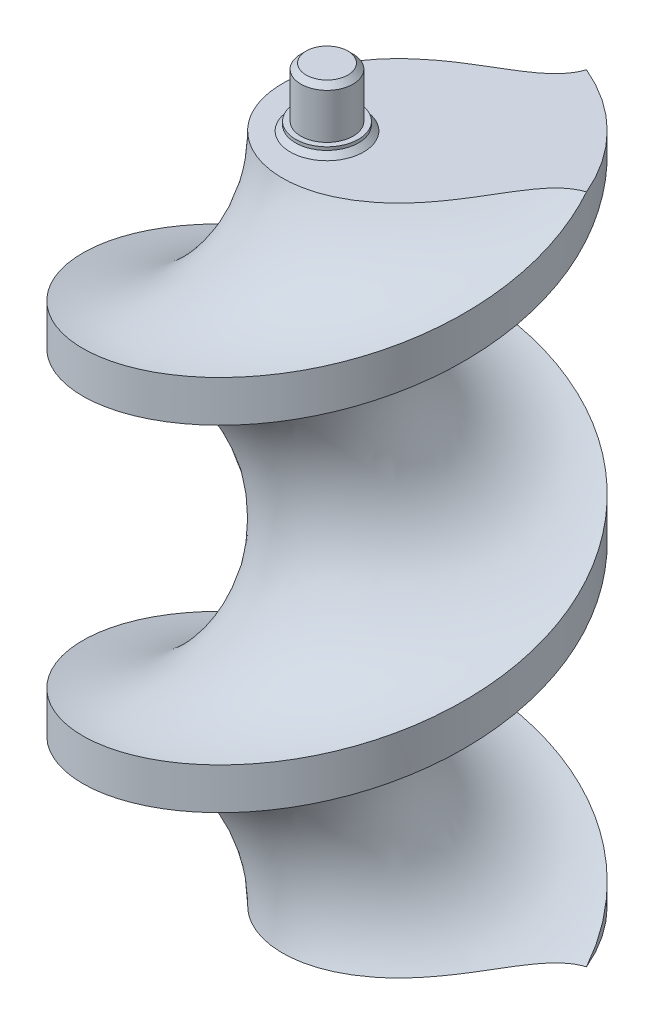
from build123d import *

# Parameters (mm, degrees)
SKETCH2_R           = 30
BOSS_EXTRUDE1_DEPTH = 50.8
CUT_SWEEP1_PITCH    = 50.8
SKETCH17_R          = 3.949999974
BOSS_EXTRUDE2_DEPTH = 8.89
SKETCH19_R          = 4.7625
BOSS_EXTRUDE3_DEPTH = 1.27
CHAMFER1_SIZE       = 0.79375
SKETCH20_W          = 5.08
SKETCH20_H          = 4.064
CUT_EXTRUDE1_DEPTH  = 7.62
SKETCH21_W          = 5.08
SKETCH21_H          = 5.08
CUT_EXTRUDE2_DEPTH  = 2.54


with BuildPart() as part:
    # Sketch2 → Boss-Extrude1 (new, symmetric)
    with BuildSketch(Plane(origin=(0, 0, 0), x_dir=(1, 0, 0), z_dir=(0, 1, 0))):
        with Locations(Location((0, 0, 0), (0, 0, 270))):
            Circle(SKETCH2_R)
    extrude(amount=BOSS_EXTRUDE1_DEPTH, both=True)

    # Cut-Sweep1: arcs per turn and ends read off the stored shape
    # Cut-Sweep1: the profile of Cut-Sweep1 profile screwed along a right-hand helix through 4 turns, 28 arcs to a turn; built about Z, then put on its axis
    cut_sweep1_z = Axis((0, 0, 0), (0, 0, 1))
    cut_sweep1_corners = [(51.5, 0, -50.8), (30, 5.594686686, -71.559322746), (8.5, 0, -50.8), (30, -5.594686686, -30.040677254)]
    with BuildLine(mode=Mode.PRIVATE) as cut_sweep1_profile:
        ThreePointArc((51.5, 0, -50.8), (45.202795796, 3.956040894, -65.479057887), (30, 5.594686686, -71.559322746))
        ThreePointArc((30, 5.594686686, -71.559322746), (14.797204204, 3.956040894, -65.479057887), (8.5, 0, -50.8))
        ThreePointArc((8.5, 0, -50.8), (14.797204204, -3.956040894, -36.120942113), (30, -5.594686686, -30.040677254))
        ThreePointArc((30, -5.594686686, -30.040677254), (45.202795796, -3.956040894, -36.120942113), (51.5, 0, -50.8))
    cut_sweep1_cap = Face(cut_sweep1_profile.wire())
    cut_sweep1_arcs = [((51.5, 0, -50.8), (51.5, 5.594686686, -71.559322746), (30, 5.594686686, -71.559322746), (1, 0.7071067811865476, 1)), ((30, 5.594686686, -71.559322746), (8.5, 5.594686686, -71.559322746), (8.5, 0, -50.8), (1, 0.7071067811865476, 1)), ((8.5, 0, -50.8), (8.5, -5.594686686, -30.040677254), (30, -5.594686686, -30.040677254), (1, 0.7071067811865476, 1)), ((30, -5.594686686, -30.040677254), (51.5, -5.594686686, -30.040677254), (51.5, 0, -50.8), (1, 0.7071067811865476, 1))]  # start, shoulder, end, weights
    cut_sweep1_turn_angles = [0, 6.428571429, 12.857142857, 19.285714286, 25.714285714, 32.142857143, 38.571428571, 45, 51.428571429, 57.857142857, 64.285714286, 70.714285714, 77.142857143, 83.571428571, 90, 96.428571429, 102.857142857, 109.285714286, 115.714285714, 122.142857143, 128.571428571, 135, 141.428571429, 147.857142857, 154.285714286, 160.714285714, 167.142857143, 173.571428571, 180, 186.428571429, 192.857142857, 199.285714286, 205.714285714, 212.142857143, 218.571428571, 225, 231.428571429, 237.857142857, 244.285714286, 250.714285714, 257.142857143, 263.571428571, 270, 276.428571429, 282.857142857, 289.285714286, 295.714285714, 302.142857143, 308.571428571, 315, 321.428571429, 327.857142857, 334.285714286, 340.714285714, 347.142857143, 353.571428571, 360]
    cut_sweep1_turn_weights = [1, 0.9937122098932426, 1, 0.9937122098932426, 1, 0.9937122098932426, 1, 0.9937122098932426, 1, 0.9937122098932426, 1, 0.9937122098932426, 1, 0.9937122098932426, 1, 0.9937122098932426, 1, 0.9937122098932426, 1, 0.9937122098932426, 1, 0.9937122098932426, 1, 0.9937122098932426, 1, 0.9937122098932426, 1, 0.9937122098932426, 1, 0.9937122098932426, 1, 0.9937122098932426, 1, 0.9937122098932426, 1, 0.9937122098932426, 1, 0.9937122098932426, 1, 0.9937122098932426, 1, 0.9937122098932426, 1, 0.9937122098932426, 1, 0.9937122098932426, 1, 0.9937122098932426, 1, 0.9937122098932426, 1, 0.9937122098932426, 1, 0.9937122098932426, 1, 0.9937122098932426, 1]
    cut_sweep1_turn_sides = [Face.make_bezier_surface([[Vector(p[j][0], p[j][1], 0).rotate(cut_sweep1_z, cut_sweep1_turn_angles[2 * i + k]) / cut_sweep1_turn_weights[2 * i + k] + Vector(0, 0, p[j][2] + CUT_SWEEP1_PITCH * cut_sweep1_turn_angles[2 * i + k] / 360) for k in range(3)] for j in range(3)], [[p[3][j] * cut_sweep1_turn_weights[2 * i + k] for k in range(3)] for j in range(3)]) for p in cut_sweep1_arcs for i in range(28)]
    cut_sweep1 = Plane(origin=(0, -50.8, 0), x_dir=(-0.7071067811865537, 0, 0.7071067811865414), z_dir=(0, 1, 0)) * Solid(Shell([*[p.moved(Location((0, 0, CUT_SWEEP1_PITCH * i))) for i in range(4) for p in cut_sweep1_turn_sides], cut_sweep1_cap, cut_sweep1_cap.rotate(cut_sweep1_z, 1440).moved(Location((0, 0, CUT_SWEEP1_PITCH * 1440 / 360)))]))
    add(cut_sweep1, mode=Mode.SUBTRACT)

    # Sketch17 → Boss-Extrude2 (add)
    with BuildSketch(Plane(origin=(0, 50.8, 0), x_dir=(1, 0, 0), z_dir=(0, 1, 0))):
        with Locations(Location((0, 0, 0), (0, 0, 270))):
            Circle(SKETCH17_R)
    extrude(amount=BOSS_EXTRUDE2_DEPTH)

    # Sketch19 → Boss-Extrude3 (add)
    with BuildSketch(Plane(origin=(0, 50.8, 0), x_dir=(1, 0, 0), z_dir=(0, 1, 0))):
        with Locations(Location((0, 0, 0), (0, 0, 270))):
            Circle(SKETCH19_R)
    extrude(amount=BOSS_EXTRUDE3_DEPTH)

    # Chamfer1
    chamfer1_edges = [part.edges().sort_by_distance(p)[0] for p in [
        (0, 59.69, -3.949999974),
        (0, 50.8, -4.7625),
    ]]
    chamfer(chamfer1_edges, length=CHAMFER1_SIZE)

    # Sketch20 → Cut-Extrude1 (cut)
    with BuildSketch(Plane.XZ.offset(50.8)):
        Rectangle(SKETCH20_W, SKETCH20_H)
    extrude(amount=-CUT_EXTRUDE1_DEPTH, mode=Mode.SUBTRACT)

    # Sketch21 → Cut-Extrude2 (cut)
    with BuildSketch(Plane.XZ.offset(50.8)):
        Rectangle(SKETCH21_W, SKETCH21_H)
    extrude(amount=-CUT_EXTRUDE2_DEPTH, mode=Mode.SUBTRACT)


solid = part.part
